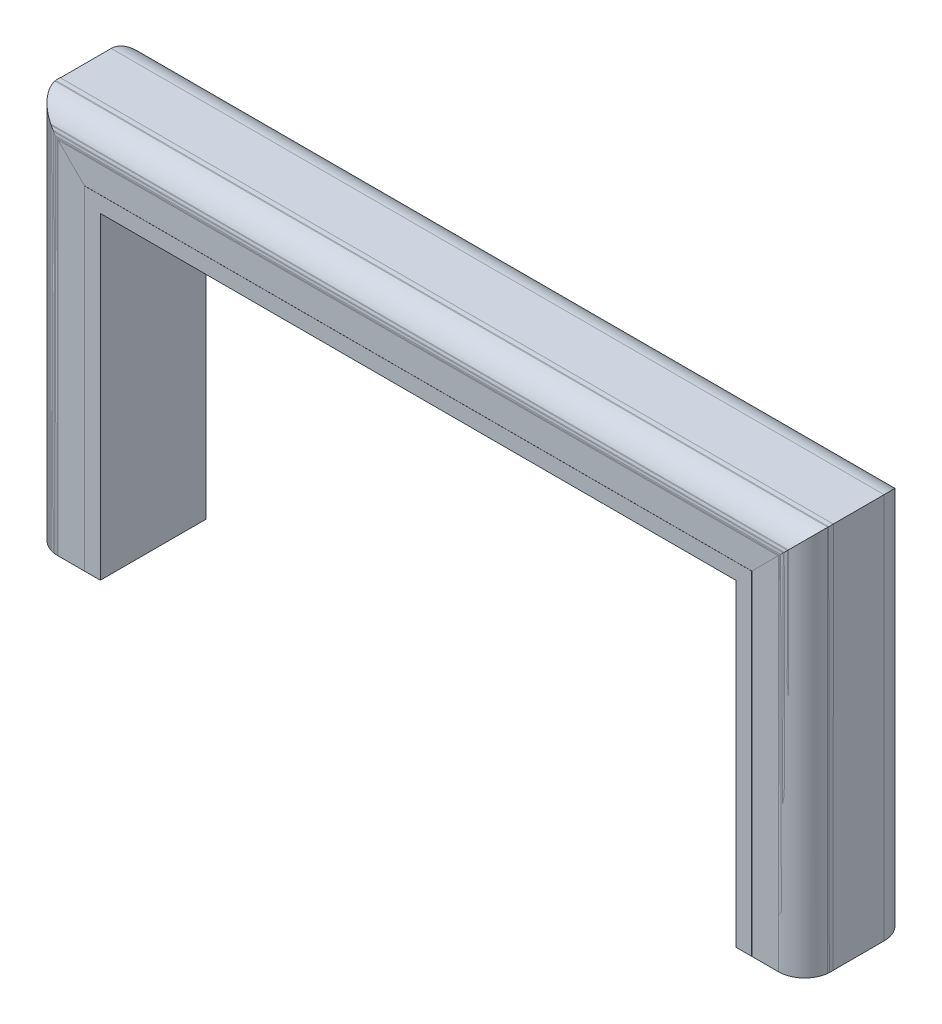
from build123d import *

# Parameters (mm, degrees)
PLYWOOD_DEPTH = 127
SKETCH2_R     = 31.75
SKETCH2_R_2   = 31.623


with BuildPart() as part:
    # Sketch1 → Plywood (new body)
    with BuildSketch(Plane.XY):
        Polygon((-400.05, 0), (-400.05, 400.05), (400.05, 400.05), (400.05, 0), (381, 0), (381, 381), (-381, 381), (-381, 0), align=None)
    extrude(amount=PLYWOOD_DEPTH)


with BuildPart() as body_2:
    # Sweep1: sweep along a path in Sketch3
    with BuildLine(Plane.XY.offset(95.25)) as sweep1_path:
        Line((-431.8, 0), (-431.8, 431.8))
        Line((-431.8, 431.8), (431.8, 431.8))
        Line((431.8, 431.8), (431.8, 0))
    # Sketch2 → Sweep1 (sweep)
    with BuildSketch(Plane.XZ):
        with Locations((-431.8, 95.25)):
            Circle(SKETCH2_R)
        with Locations((-431.673, 31.623)):
            Circle(SKETCH2_R_2)
    sweep(path=sweep1_path.line, transition=Transition.RIGHT)


with BuildPart() as body_3:
    # Sweep2: sweep along a path in Sketch4
    with BuildLine(Plane.XY.offset(31.623)) as sweep2_path:
        Line((-431.673, 0), (-431.673, 431.8))
        Line((-431.673, 431.8), (431.8, 431.8))
        Line((431.8, 431.8), (431.8, 0))
    # Sketch6 → Sweep2 (sweep)
    with BuildSketch(Plane.XZ):
        with BuildLine():
            Line((-431.673, 0), (-400.05, 0))
            Line((-400.05, 0), (-400.05, 127))
            Line((-400.05, 127), (-431.8, 127))
            ThreePointArc((-431.8, 127), (-452.785790865, 119.075597196), (-463.296, 99.258052395))
            Line((-463.296, 99.258052395), (-463.296, 91.241947605))
            Line((-463.296, 91.241947605), (-463.296, 31.623))
            ThreePointArc((-463.296, 31.623), (-454.033837741, 9.262162259), (-431.673, 0))
        make_face()
    sweep(path=sweep2_path.line, transition=Transition.RIGHT)


solid = Compound([part.part, body_2.part, body_3.part])
